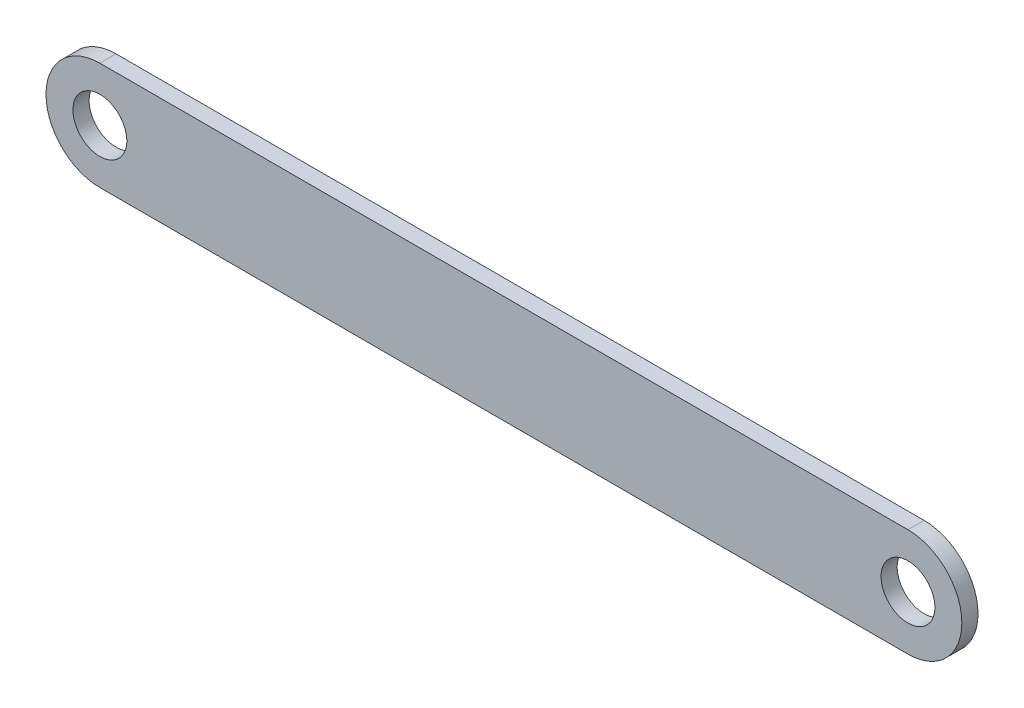
from build123d import *

# Parameters (mm, degrees)
SKETCH1_R           = 5
BOSS_EXTRUDE1_DEPTH = 3


with BuildPart() as part:
    # Sketch1 → Boss-Extrude1 (new body)
    with BuildSketch(Plane.XY):
        with BuildLine():
            Line((75, -10), (-75, -10))
            ThreePointArc((-75, -10), (-85, 0), (-75, 10))
            Line((-75, 10), (75, 10))
            ThreePointArc((75, 10), (85, 0), (75, -10))
        make_face()
        with Locations((75, 0)):
            Circle(SKETCH1_R, mode=Mode.SUBTRACT)
        with Locations((-75, 0)):
            Circle(SKETCH1_R, mode=Mode.SUBTRACT)
    extrude(amount=BOSS_EXTRUDE1_DEPTH)


solid = part.part
